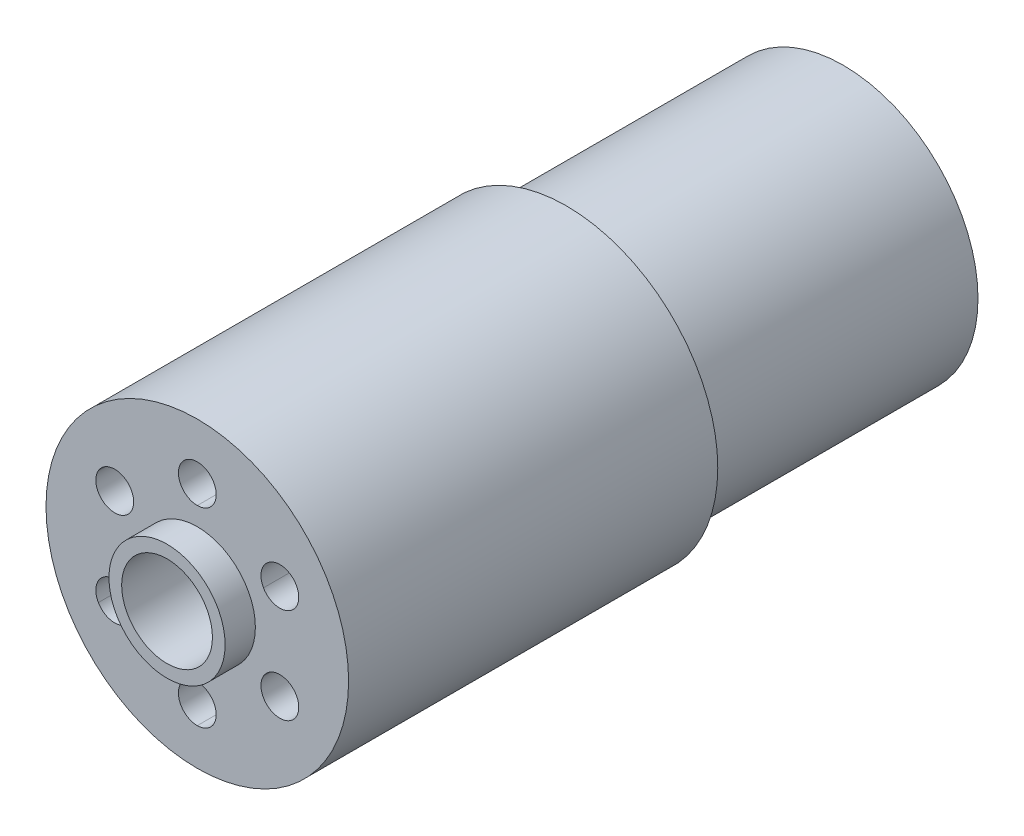
from build123d import *

# Parameters (mm, degrees)
SKETCH1_R           = 25.4
BOSS_EXTRUDE2_DEPTH = 108.458
SKETCH6_R           = 7.62
SKETCH6_R_2         = 3.175
CUT_EXTRUDE1_DEPTH  = 108.458
SKETCH7_R           = 25.4
SKETCH7_R_2         = 22.606
CUT_EXTRUDE2_DEPTH  = 46.482
SKETCH8_R           = 9.75
SKETCH8_R_2         = 7.62
BOSS_EXTRUDE7_DEPTH = 5.08
BOSS_EXTRUDE8_START = 5.08
SKETCH9_R           = 9.75
SKETCH9_R_2         = 7.62
BOSS_EXTRUDE8_DEPTH = 5.08


with BuildPart() as part:
    # Sketch1 → Boss-Extrude2 (new body)
    with BuildSketch(Plane.XY):
        Circle(SKETCH1_R)
    extrude(amount=BOSS_EXTRUDE2_DEPTH)

    # Sketch6 → Cut-Extrude1 (cut)
    with BuildSketch(Plane(origin=(0, 0, 0), x_dir=(-1, 0, 0), z_dir=(0, 0, -1))):
        Circle(SKETCH6_R)
        with Locations((-13.858138511, 8.001)):
            Circle(SKETCH6_R_2)
        with Locations((0, 16.002)):
            Circle(SKETCH6_R_2)
        with Locations((13.858138511, 8.001)):
            Circle(SKETCH6_R_2)
        with Locations((13.858138511, -8.001)):
            Circle(SKETCH6_R_2)
        with Locations((0, -16.002)):
            Circle(SKETCH6_R_2)
        with Locations((-13.858138511, -8.001)):
            Circle(SKETCH6_R_2)
    extrude(amount=-CUT_EXTRUDE1_DEPTH, mode=Mode.SUBTRACT)

    # Sketch7 → Cut-Extrude2 (cut)
    with BuildSketch(Plane(origin=(0, 0, 0), x_dir=(-1, 0, 0), z_dir=(0, 0, -1))):
        Circle(SKETCH7_R)
        Circle(SKETCH7_R_2, mode=Mode.SUBTRACT)
    extrude(amount=-CUT_EXTRUDE2_DEPTH, mode=Mode.SUBTRACT)

    # Sketch8 → Boss-Extrude7 (add)
    with BuildSketch(Plane.XY.offset(108.458)):
        Circle(SKETCH8_R)
        Circle(SKETCH8_R_2, mode=Mode.SUBTRACT)
    extrude(amount=BOSS_EXTRUDE7_DEPTH)

    # Sketch9 → Boss-Extrude8 (add)
    with BuildSketch(Plane(origin=(0, 0, 0), x_dir=(-1, 0, 0), z_dir=(0, 0, -1)).offset(BOSS_EXTRUDE8_START)):
        Circle(SKETCH9_R)
        Circle(SKETCH9_R_2, mode=Mode.SUBTRACT)
    extrude(amount=-BOSS_EXTRUDE8_DEPTH)


solid = part.part
